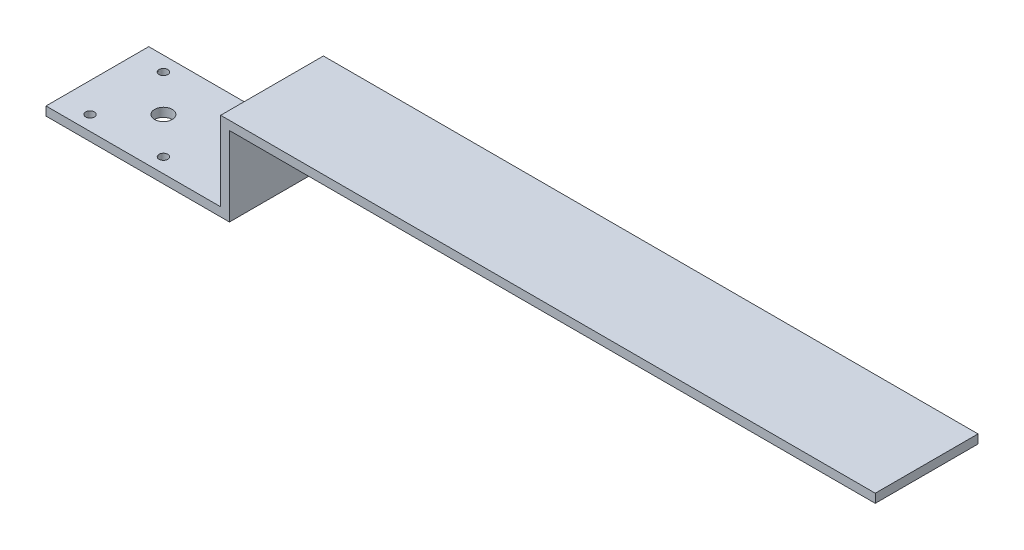
from build123d import *

# Parameters (mm, degrees)
SKETCH1_W           = 62.5
SKETCH1_H           = 35
SKETCH1_R           = 1.5
SKETCH1_R_2         = 3
BOSS_EXTRUDE1_DEPTH = 3
SKETCH3_W           = 3
SKETCH3_H           = 35
BOSS_EXTRUDE3_DEPTH = 27
SKETCH4_W           = 35
SKETCH4_H           = 3
BOSS_EXTRUDE4_DEPTH = 220
SKETCH5_R           = 1.5
CUT_EXTRUDE1_DEPTH  = 10


with BuildPart() as part:
    # Sketch1 → Boss-Extrude1 (new body)
    with BuildSketch(Plane(origin=(0, 0, 0), x_dir=(1, 0, 0), z_dir=(0, 1, 0))):
        Rectangle(SKETCH1_W, SKETCH1_H)
        with Locations((-21.25, 12.5)):
            Circle(SKETCH1_R, mode=Mode.SUBTRACT)
        with Locations((-21.25, -12.5)):
            Circle(SKETCH1_R, mode=Mode.SUBTRACT)
        with Locations((3.75, 12.5)):
            Circle(SKETCH1_R, mode=Mode.SUBTRACT)
        with Locations((3.75, -12.5)):
            Circle(SKETCH1_R, mode=Mode.SUBTRACT)
        with Locations((-8.75, 0)):
            Circle(SKETCH1_R_2, mode=Mode.SUBTRACT)
    extrude(amount=BOSS_EXTRUDE1_DEPTH)

    # Sketch3 → Boss-Extrude3 (add)
    with BuildSketch(Plane(origin=(0, 3, 0), x_dir=(1, 0, 0), z_dir=(0, 1, 0))):
        with Locations((29.75, 0)):
            Rectangle(SKETCH3_W, SKETCH3_H)
    extrude(amount=BOSS_EXTRUDE3_DEPTH)

    # Sketch4 → Boss-Extrude4 (add)
    with BuildSketch(Plane(origin=(31.25, 0, 0), x_dir=(0, 0, -1), z_dir=(1, 0, 0))):
        with Locations((0, 28.5)):
            Rectangle(SKETCH4_W, SKETCH4_H)
    extrude(amount=BOSS_EXTRUDE4_DEPTH)

    # Sketch5 → Cut-Extrude1 (cut)
    with BuildSketch(Plane(origin=(31.25, 0, 0), x_dir=(0, 0, -1), z_dir=(1, 0, 0))):
        with Locations((12.5, 24)):
            Circle(SKETCH5_R)
    extrude(amount=-CUT_EXTRUDE1_DEPTH, mode=Mode.SUBTRACT)


solid = part.part
